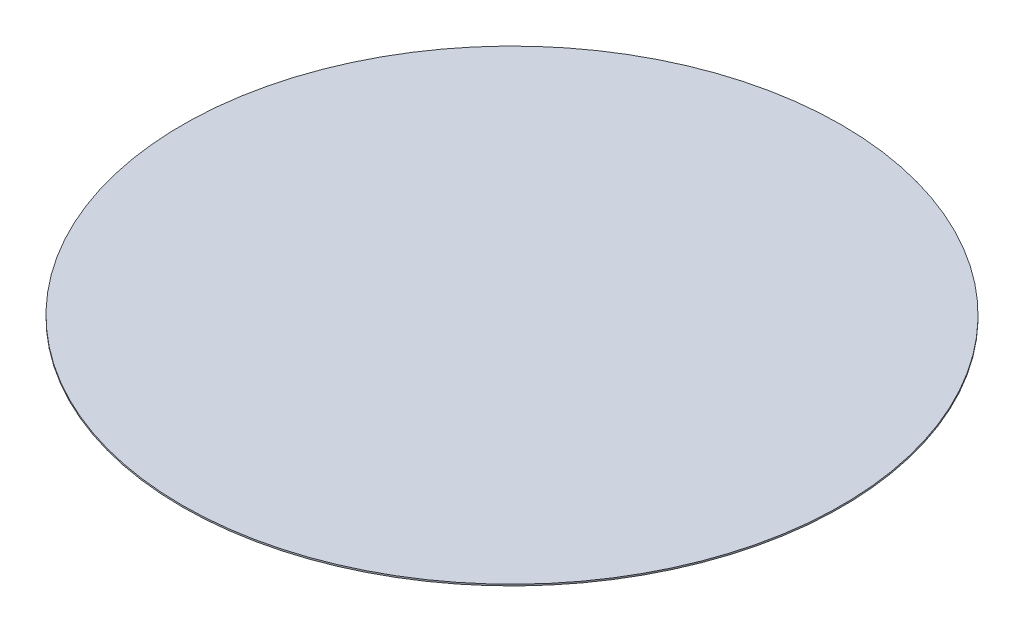
from build123d import *

# Parameters (mm, degrees)
SKETCH1_R           = 11
BOSS_EXTRUDE1_DEPTH = 0.05


with BuildPart() as part:
    # Sketch1 → Boss-Extrude1 (new body)
    with BuildSketch(Plane(origin=(0, 0, 0), x_dir=(1, 0, 0), z_dir=(0, 1, 0))):
        Circle(SKETCH1_R)
    extrude(amount=BOSS_EXTRUDE1_DEPTH)


solid = part.part
